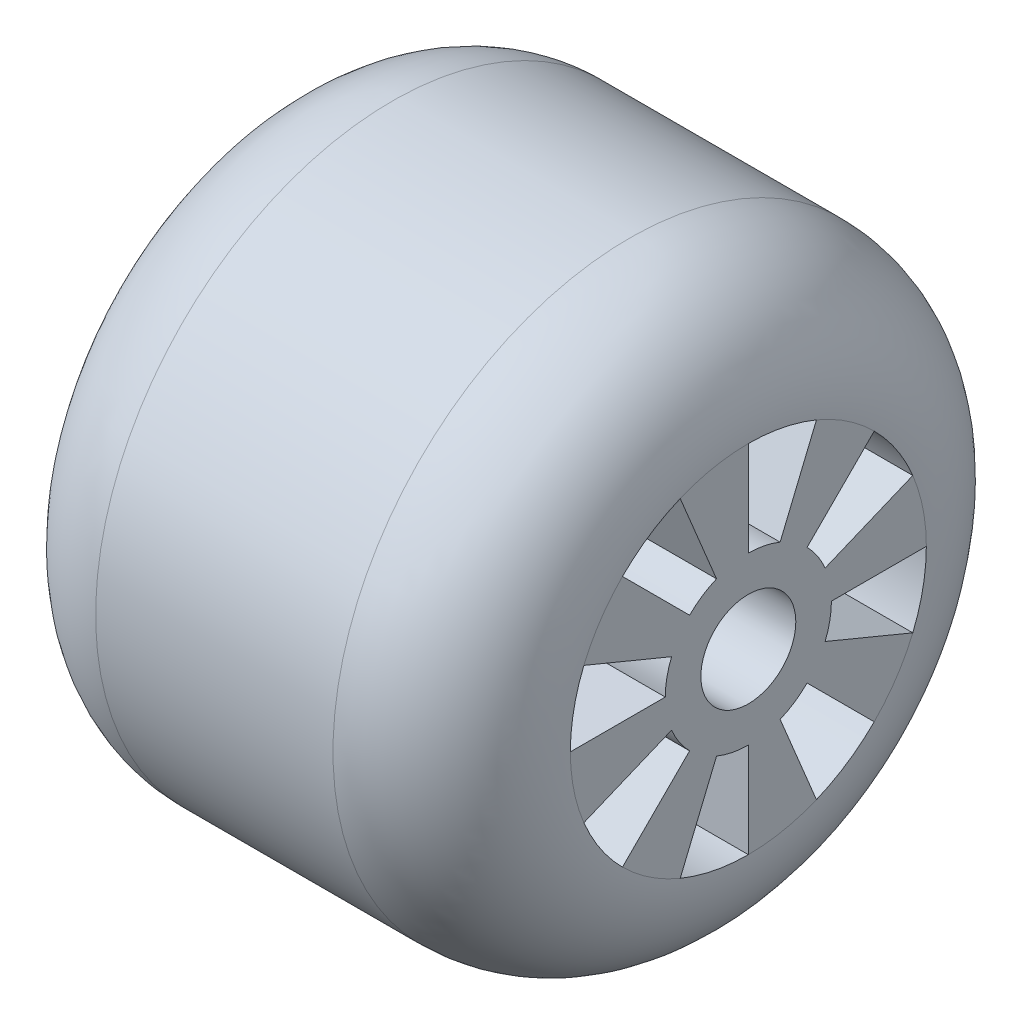
from build123d import *

# Parameters (mm, degrees)
SKETCH2_R           = 12.5
SKETCH2_R_2         = 2
BOSS_EXTRUDE2_DEPTH = 20
FILLET2_R           = 5


with BuildPart() as part:
    # Sketch2 → Boss-Extrude2 (new body)
    with BuildSketch(Plane(origin=(0, 0, 0), x_dir=(0, 0, -1), z_dir=(1, 0, 0))):
        Circle(SKETCH2_R)
        with BuildLine():
            Line((0, 3.5), (0, 7.5))
            ThreePointArc((0, 7.5), (1.463177415, 7.355889603), (2.870125743, 6.929096494))
            Line((2.870125743, 6.929096494), (1.339392013, 3.233578364))
            ThreePointArc((1.339392013, 3.233578364), (0.682816127, 3.432748481), (0, 3.5))
        make_face(mode=Mode.SUBTRACT)
        with BuildLine():
            Line((-2.870125743, 6.929096494), (-1.339392013, 3.233578364))
            ThreePointArc((-1.339392013, 3.233578364), (-1.944495816, 2.910143643), (-2.474873734, 2.474873734))
            Line((-2.474873734, 2.474873734), (-5.303300859, 5.303300859))
            ThreePointArc((-5.303300859, 5.303300859), (-4.166776748, 6.236022092), (-2.870125743, 6.929096494))
        make_face(mode=Mode.SUBTRACT)
        with BuildLine():
            Line((-6.929096494, 2.870125743), (-3.233578364, 1.339392013))
            ThreePointArc((-3.233578364, 1.339392013), (-3.432748481, 0.682816127), (-3.5, 0))
            Line((-3.5, 0), (-7.5, 0))
            ThreePointArc((-7.5, 0), (-7.355889603, 1.463177415), (-6.929096494, 2.870125743))
        make_face(mode=Mode.SUBTRACT)
        with BuildLine():
            Line((-6.929096494, -2.870125743), (-3.233578364, -1.339392013))
            ThreePointArc((-3.233578364, -1.339392013), (-2.910143643, -1.944495816), (-2.474873734, -2.474873734))
            Line((-2.474873734, -2.474873734), (-5.303300859, -5.303300859))
            ThreePointArc((-5.303300859, -5.303300859), (-6.236022092, -4.166776748), (-6.929096494, -2.870125743))
        make_face(mode=Mode.SUBTRACT)
        with BuildLine():
            Line((-2.870125743, -6.929096494), (-1.339392013, -3.233578364))
            ThreePointArc((-1.339392013, -3.233578364), (-0.682816127, -3.432748481), (0, -3.5))
            Line((0, -3.5), (0, -7.5))
            ThreePointArc((0, -7.5), (-1.463177415, -7.355889603), (-2.870125743, -6.929096494))
        make_face(mode=Mode.SUBTRACT)
        with BuildLine():
            Line((2.870125743, -6.929096494), (1.339392013, -3.233578364))
            ThreePointArc((1.339392013, -3.233578364), (1.944495816, -2.910143643), (2.474873734, -2.474873734))
            Line((2.474873734, -2.474873734), (5.303300859, -5.303300859))
            ThreePointArc((5.303300859, -5.303300859), (4.166776748, -6.236022092), (2.870125743, -6.929096494))
        make_face(mode=Mode.SUBTRACT)
        with BuildLine():
            Line((6.929096494, -2.870125743), (3.233578364, -1.339392013))
            ThreePointArc((3.233578364, -1.339392013), (3.432748481, -0.682816127), (3.5, 0))
            Line((3.5, 0), (7.5, 0))
            ThreePointArc((7.5, 0), (7.355889603, -1.463177415), (6.929096494, -2.870125743))
        make_face(mode=Mode.SUBTRACT)
        with BuildLine():
            Line((6.929096494, 2.870125743), (3.233578364, 1.339392013))
            ThreePointArc((3.233578364, 1.339392013), (2.910143643, 1.944495816), (2.474873734, 2.474873734))
            Line((2.474873734, 2.474873734), (5.303300859, 5.303300859))
            ThreePointArc((5.303300859, 5.303300859), (6.236022092, 4.166776748), (6.929096494, 2.870125743))
        make_face(mode=Mode.SUBTRACT)
        Circle(SKETCH2_R_2, mode=Mode.SUBTRACT)
    extrude(amount=BOSS_EXTRUDE2_DEPTH)

    # Fillet2
    fillet2_edges = [part.edges().sort_by_distance(p)[0] for p in [
        (0, 0, 12.5),
        (20, 0, 12.5),
    ]]
    fillet(fillet2_edges, radius=FILLET2_R - 0.0001)  # a hair under: the kernel refuses the full size


solid = part.part
